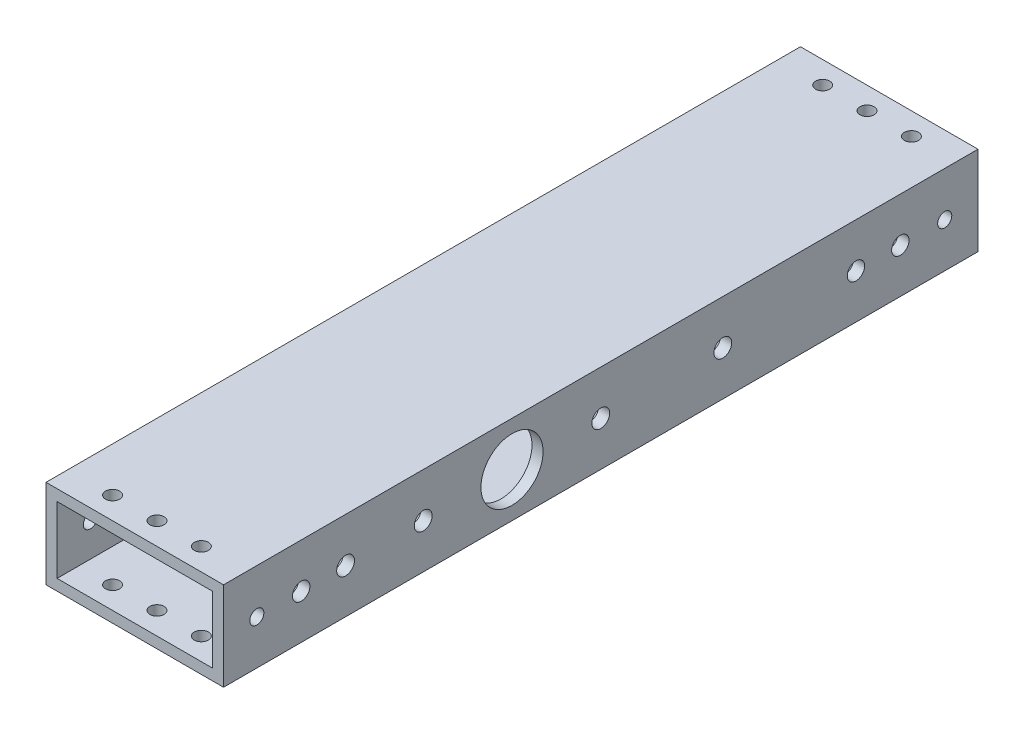
from build123d import *

# Parameters (mm, degrees)
SKETCH1_W           = 50.8
SKETCH1_H           = 25.4
SKETCH1_W_2         = 44.45
SKETCH1_H_2         = 19.05
BOSS_EXTRUDE1_DEPTH = 107.95
SKETCH2_R           = 2.0193
SKETCH2_R_2         = 2.4892
CUT_EXTRUDE1_DEPTH  = 120.979717036
SKETCH3_R           = 2.0193
CUT_EXTRUDE2_DEPTH  = 114.769602707
SKETCH4_R           = 8.89
SKETCH4_R_2         = 2.5527
CUT_EXTRUDE3_DEPTH  = 120.979717036
CUT_EXTRUDE4_REACH  = 115.77
SKETCH5_R           = 2.5527


with BuildPart() as part:
    # Sketch1 → Boss-Extrude1 (new, symmetric)
    with BuildSketch(Plane.XY):
        Rectangle(SKETCH1_W, SKETCH1_H)
        Rectangle(SKETCH1_W_2, SKETCH1_H_2, mode=Mode.SUBTRACT)
    extrude(amount=BOSS_EXTRUDE1_DEPTH, both=True)

    # Sketch2 → Cut-Extrude1 (cut, through all)
    with BuildSketch(Plane(origin=(25.4, 0, 0), x_dir=(0, 0, -1), z_dir=(1, 0, 0))):
        with Locations((-98.425, 0)):
            Circle(SKETCH2_R)
        with Locations((98.425, 0)):
            Circle(SKETCH2_R)
        with Locations((-85.725, 0)):
            Circle(SKETCH2_R_2)
        with Locations((-73.025, 0)):
            Circle(SKETCH2_R_2)
        with Locations((73.025, 0)):
            Circle(SKETCH2_R_2)
        with Locations((85.725, 0)):
            Circle(SKETCH2_R_2)
    extrude(amount=-CUT_EXTRUDE1_DEPTH, mode=Mode.SUBTRACT)

    # Sketch3 → Cut-Extrude2 (cut, through all)
    with BuildSketch(Plane(origin=(0, 12.7, 0), x_dir=(1, 0, 0), z_dir=(0, 1, 0))):
        with Locations((-12.7, -101.6)):
            Circle(SKETCH3_R)
        with Locations((0, -101.6)):
            Circle(SKETCH3_R)
        with Locations((12.7, -101.6)):
            Circle(SKETCH3_R)
        with Locations((12.7, 101.6)):
            Circle(SKETCH3_R)
        with Locations((0, 101.6)):
            Circle(SKETCH3_R)
        with Locations((-12.7, 101.6)):
            Circle(SKETCH3_R)
    extrude(amount=-CUT_EXTRUDE2_DEPTH, mode=Mode.SUBTRACT)

    # Sketch4 → Cut-Extrude3 (cut, through all)
    with BuildSketch(Plane(origin=(25.4, 0, 0), x_dir=(0, 0, -1), z_dir=(1, 0, 0))):
        with Locations((-25.4, 0)):
            Circle(SKETCH4_R)
        with Locations((-73.025, 0)):
            Circle(SKETCH4_R_2)
        with Locations((34.925, 0)):
            Circle(SKETCH4_R_2)
        Circle(SKETCH4_R_2)
        with Locations((-50.8, 0)):
            Circle(SKETCH4_R_2)
    extrude(amount=-CUT_EXTRUDE3_DEPTH, mode=Mode.SUBTRACT)

    # Sketch5 → Cut-Extrude4 (cut, up to next)
    with BuildSketch(Plane.XZ.offset(12.7), mode=Mode.PRIVATE) as cut_extrude4_sk1:
        with Locations((-3.81, 63.5)):
            Circle(SKETCH5_R)
    cut_extrude4_tool1 = extrude(cut_extrude4_sk1.sketch, amount=-CUT_EXTRUDE4_REACH, mode=Mode.PRIVATE) & part.part
    # Sketch5 → Cut-Extrude4 (cut, up to next)
    with BuildSketch(Plane.XZ.offset(12.7), mode=Mode.PRIVATE) as cut_extrude4_sk2:
        with Locations((-16.51, 63.5)):
            Circle(SKETCH5_R)
    cut_extrude4_tool2 = extrude(cut_extrude4_sk2.sketch, amount=-CUT_EXTRUDE4_REACH, mode=Mode.PRIVATE) & part.part
    # Sketch5 → Cut-Extrude4 (cut, up to next)
    with BuildSketch(Plane.XZ.offset(12.7), mode=Mode.PRIVATE) as cut_extrude4_sk3:
        with Locations((-16.51, 50.8)):
            Circle(SKETCH5_R)
    cut_extrude4_tool3 = extrude(cut_extrude4_sk3.sketch, amount=-CUT_EXTRUDE4_REACH, mode=Mode.PRIVATE) & part.part
    # Sketch5 → Cut-Extrude4 (cut, up to next)
    with BuildSketch(Plane.XZ.offset(12.7), mode=Mode.PRIVATE) as cut_extrude4_sk4:
        with Locations((-3.81, 50.8)):
            Circle(SKETCH5_R)
    cut_extrude4_tool4 = extrude(cut_extrude4_sk4.sketch, amount=-CUT_EXTRUDE4_REACH, mode=Mode.PRIVATE) & part.part
    # Sketch5 → Cut-Extrude4 (cut, up to next)
    with BuildSketch(Plane.XZ.offset(12.7), mode=Mode.PRIVATE) as cut_extrude4_sk5:
        with Locations((-16.51, -12.7)):
            Circle(SKETCH5_R)
    cut_extrude4_tool5 = extrude(cut_extrude4_sk5.sketch, amount=-CUT_EXTRUDE4_REACH, mode=Mode.PRIVATE) & part.part
    # Sketch5 → Cut-Extrude4 (cut, up to next)
    with BuildSketch(Plane.XZ.offset(12.7), mode=Mode.PRIVATE) as cut_extrude4_sk6:
        with Locations((-3.81, -12.7)):
            Circle(SKETCH5_R)
    cut_extrude4_tool6 = extrude(cut_extrude4_sk6.sketch, amount=-CUT_EXTRUDE4_REACH, mode=Mode.PRIVATE) & part.part
    # Sketch5 → Cut-Extrude4 (cut, up to next)
    with BuildSketch(Plane.XZ.offset(12.7), mode=Mode.PRIVATE) as cut_extrude4_sk7:
        with Locations((-3.81, 0)):
            Circle(SKETCH5_R)
    cut_extrude4_tool7 = extrude(cut_extrude4_sk7.sketch, amount=-CUT_EXTRUDE4_REACH, mode=Mode.PRIVATE) & part.part
    # Sketch5 → Cut-Extrude4 (cut, up to next)
    with BuildSketch(Plane.XZ.offset(12.7), mode=Mode.PRIVATE) as cut_extrude4_sk8:
        with Locations((-16.51, 0)):
            Circle(SKETCH5_R)
    cut_extrude4_tool8 = extrude(cut_extrude4_sk8.sketch, amount=-CUT_EXTRUDE4_REACH, mode=Mode.PRIVATE) & part.part
    add(cut_extrude4_tool1.solids().sort_by_distance((-3.81, -12.7, 63.5))[0], mode=Mode.SUBTRACT)
    add(cut_extrude4_tool2.solids().sort_by_distance((-16.51, -12.7, 63.5))[0], mode=Mode.SUBTRACT)
    add(cut_extrude4_tool3.solids().sort_by_distance((-16.51, -12.7, 50.8))[0], mode=Mode.SUBTRACT)
    add(cut_extrude4_tool4.solids().sort_by_distance((-3.81, -12.7, 50.8))[0], mode=Mode.SUBTRACT)
    add(cut_extrude4_tool5.solids().sort_by_distance((-16.51, -12.7, -12.7))[0], mode=Mode.SUBTRACT)
    add(cut_extrude4_tool6.solids().sort_by_distance((-3.81, -12.7, -12.7))[0], mode=Mode.SUBTRACT)
    add(cut_extrude4_tool7.solids().sort_by_distance((-3.81, -12.7, 0))[0], mode=Mode.SUBTRACT)
    add(cut_extrude4_tool8.solids().sort_by_distance((-16.51, -12.7, 0))[0], mode=Mode.SUBTRACT)


solid = part.part
